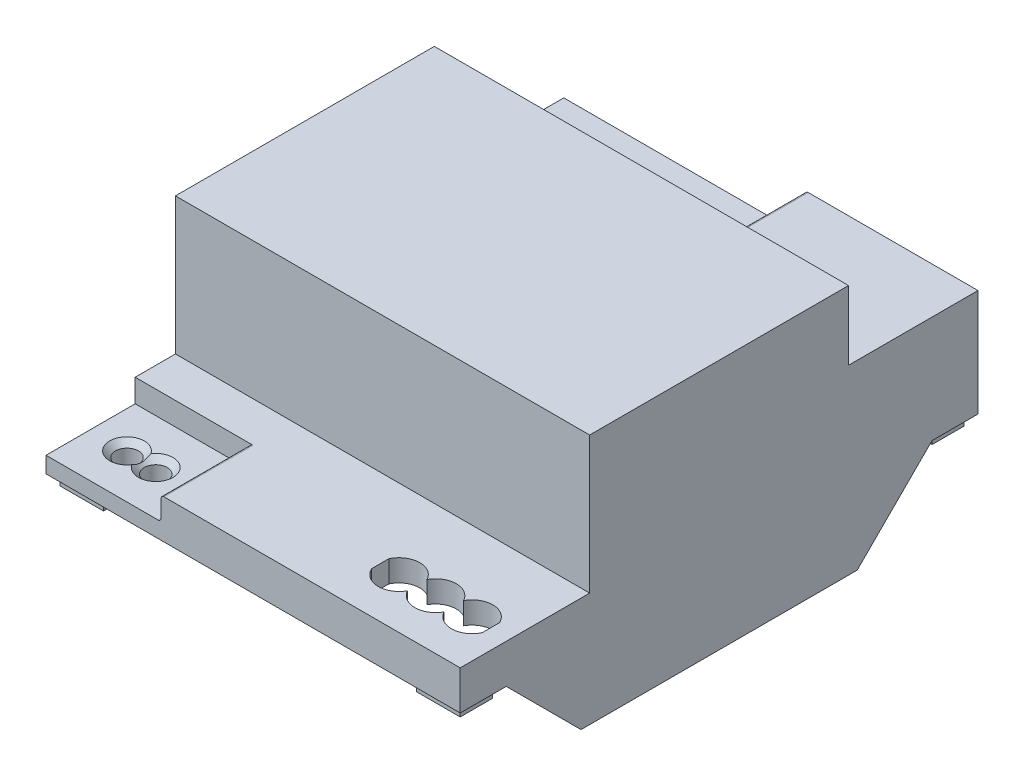
from build123d import *

# Parameters (mm, degrees)
SKETCH_1_W            = 72
SKETCH_1_H            = 90
EXTRUDE_1_DEPTH       = 43.6
CUT_EXTRUDE_1_DEPTH   = 72
SKETCH_3_W            = 22.5
SKETCH_3_H            = 23.8
CUT_EXTRUDE_2_DEPTH   = 72
CUT_EXTRUDE_4_DEPTH   = 16
SKETCH_6_W            = 68
SKETCH_6_H            = 41
CUT_EXTRUDE_5_DEPTH   = 42
EXTRUDE_2_DEPTH       = 1.8
MIRROR_5_COPY_1_DEPTH = 1.8
CUT_EXTRUDE_6_DEPTH   = 3.8
SKETCH_10_W           = 20
SKETCH_10_H           = 22.5
EXTRUDE_3_DEPTH       = 4
SKETCH_9_W            = 15.5
SKETCH_9_H            = 4
CUT_EXTRUDE_7_DEPTH   = 20
SKETCH_11_R           = 2
CUT_EXTRUDE_8_DEPTH   = 4
CHAMFER_1_SIZE        = 1
SKETCH_13_W           = 20
SKETCH_13_H           = 7
CUT_EXTRUDE_10_DEPTH  = 1.6
SKETCH_15_W           = 48
SKETCH_15_H           = 7
EXTRUDE_4_DEPTH       = 2.4
SKETCH_14_R           = 1.75
CUT_EXTRUDE_11_DEPTH  = 5
SKETCH_16_W           = 68
SKETCH_16_H           = 22.5
CUT_EXTRUDE_12_DEPTH  = 30
SKETCH_19_W           = 16
SKETCH_19_H           = 14
CUT_EXTRUDE_13_DEPTH  = 2
SKETCH_20_R           = 4
SKETCH_20_R_2         = 1.75
SKETCH_20_W           = 6.2
SKETCH_20_H           = 6.2
EXTRUDE_5_DEPTH       = 16.4
SKETCH_21_W           = 2.6
SKETCH_21_H           = 3
CUT_EXTRUDE_14_DEPTH  = 2
SKETCH_22_R           = 1.75
EXTRUDE_6_DEPTH       = 11.4
SKETCH_24_W           = 43
SKETCH_24_H           = 22.5
EXTRUDE_7_DEPTH       = 7.5
CHAMFER_3_SIZE        = 0.5
SKETCH_28_W           = 22.5
SKETCH_28_H           = 12
CUT_EXTRUDE_17_DEPTH  = 72
SKETCH_29_W           = 22.5
SKETCH_29_H           = 7
CUT_EXTRUDE_18_DEPTH  = 42
CUT_EXTRUDE_19_DEPTH  = 4
FILLET_3_R            = 0.2
CHAMFER_4_SIZE        = 0.2
SKETCH_31_W           = 20
SKETCH_31_H           = 0.8
EXTRUDE_8_DEPTH       = 1.8
FILLET_4_R            = 0.5


with BuildPart() as part:
    # 草图1 → 凸台-拉伸1 (new body)
    with BuildSketch(Plane(origin=(0, 0, 0), x_dir=(1, 0, 0), z_dir=(0, 1, 0))):
        Rectangle(SKETCH_1_W, SKETCH_1_H)
    extrude(amount=EXTRUDE_1_DEPTH)

    # 草图2 → 切除-拉伸1 (cut)
    with BuildSketch(Plane(origin=(36, 0, 0), x_dir=(0, 0, -1), z_dir=(1, 0, 0))):
        Polygon((-45, 0), (-45, 13), (-37, 13), (-24, 0), align=None)
    cut_extrude_1 = extrude(amount=-CUT_EXTRUDE_1_DEPTH, mode=Mode.SUBTRACT)

    # 镜向1: 切除-拉伸1 across plane
    add(cut_extrude_1.mirror(Plane(origin=(0, 0, 0), x_dir=(1, 0, 0), z_dir=(0, 0, -1))), mode=Mode.SUBTRACT)

    # 草图3 → 切除-拉伸2 (cut)
    with BuildSketch(Plane(origin=(36, 0, 0), x_dir=(0, 0, -1), z_dir=(1, 0, 0))):
        with Locations((-33.75, 31.7)):
            Rectangle(SKETCH_3_W, SKETCH_3_H)
    extrude(amount=-CUT_EXTRUDE_2_DEPTH, mode=Mode.SUBTRACT)

    # 草图5 → 切除-拉伸4 (cut)
    with BuildSketch(Plane.XZ):
        Polygon((-34, 20.5), (34, 20.5), (34, 37), (34, 43), (-34, 43), (-34, 37), align=None)
    extrude(amount=-CUT_EXTRUDE_4_DEPTH, mode=Mode.SUBTRACT)

    # 草图6 → 切除-拉伸5 (cut)
    with BuildSketch(Plane.XZ):
        Rectangle(SKETCH_6_W, SKETCH_6_H)
    extrude(amount=-CUT_EXTRUDE_5_DEPTH, mode=Mode.SUBTRACT)

    # 草图7 → 凸台-拉伸2 (add)
    with BuildSketch(Plane.XZ.offset(-13)):
        Polygon((-34, 38.2), (-34.8, 38.2), (-34.8, 43.8), (-27.2, 43.8), (-27.2, 43), (-34, 43), align=None)
    extrude_2 = extrude(amount=EXTRUDE_2_DEPTH)

    # 镜向4: 凸台-拉伸2 across plane
    add(extrude_2.mirror(Plane(origin=(0, 0, 0), x_dir=(0, 0, 1), z_dir=(1, 0, 0))))

    # 镜向5: 凸台-拉伸2 across plane
    add(extrude_2.mirror(Plane.XY))

    # 镜向5 copy 1 sketch → 镜向5 copy 1 (add)
    with BuildSketch(Plane(origin=(0, 13, 0), x_dir=(-1, 0, 0), z_dir=(0, -1, 0))):
        Polygon((-34, 38.2), (-34.8, 38.2), (-34.8, 43.8), (-27.2, 43.8), (-27.2, 43), (-34, 43), align=None)
    extrude(amount=MIRROR_5_COPY_1_DEPTH)

    # 草图8 → 切除-拉伸6 (cut)
    with BuildSketch(Plane(origin=(0, 19.8, 0), x_dir=(1, 0, 0), z_dir=(0, 1, 0))):
        with BuildLine():
            Line((32.62, -37.774782593), (32.62, -34.785217407))
            ThreePointArc((32.62, -34.785217407), (29.457738833, -32.681765717), (26.17, -34.583127878))
            ThreePointArc((26.17, -34.583127878), (22.995, -32.68), (19.82, -34.583127878))
            ThreePointArc((19.82, -34.583127878), (16.532261167, -32.681765717), (13.37, -34.785217407))
            Line((13.37, -34.785217407), (13.37, -37.774782593))
            ThreePointArc((13.37, -37.774782593), (16.532261167, -39.878234283), (19.82, -37.976872122))
            ThreePointArc((19.82, -37.976872122), (22.995, -39.88), (26.17, -37.976872122))
            ThreePointArc((26.17, -37.976872122), (29.457738833, -39.878234283), (32.62, -37.774782593))
        make_face()
    extrude(amount=-CUT_EXTRUDE_6_DEPTH, mode=Mode.SUBTRACT)

    # 草图10 → 凸台-拉伸3 (add)
    with BuildSketch(Plane.XZ.offset(-16)):
        with Locations((-24, 31.75)):
            Rectangle(SKETCH_10_W, SKETCH_10_H)
    extrude(amount=EXTRUDE_3_DEPTH)

    # 草图9 → 切除-拉伸7 (cut)
    with BuildSketch(Plane.ZY.offset(36)):
        with Locations((37.25, 17.8)):
            Rectangle(SKETCH_9_W, SKETCH_9_H)
    extrude(amount=-CUT_EXTRUDE_7_DEPTH, mode=Mode.SUBTRACT)

    # 草图11 → 切除-拉伸8 (cut)
    with BuildSketch(Plane(origin=(0, 15.8, 0), x_dir=(1, 0, 0), z_dir=(0, 1, 0))):
        with Locations(Location((-29.622, -37.3, 0), (0, 0, 270))):
            Circle(SKETCH_11_R)
        with Locations(Location((-24.622, -37.3, 0), (0, 0, 270))):
            Circle(SKETCH_11_R)
    extrude(amount=-CUT_EXTRUDE_8_DEPTH, mode=Mode.SUBTRACT)

    # 倒角1
    # the kernel refuses this chamfer: 1 mm, written as the material it takes off along each edge
    with BuildSketch(Plane(origin=(-29.622, 15.8, 37.3), x_dir=(0, 0, 1), z_dir=(-1, 0, 0))) as chamfer_1_piece_1:
        Polygon((2 + CHAMFER_1_SIZE, 0), (2, -CHAMFER_1_SIZE), (2, 0), align=None)
    revolve(axis=Axis((-29.622, 15.8, 37.3), (0, 1, 0)), mode=Mode.SUBTRACT)
    with BuildSketch(Plane(origin=(-24.622, 15.8, 37.3), x_dir=(0, 0, 1), z_dir=(-1, 0, 0))) as chamfer_1_piece_2:
        Polygon((2 + CHAMFER_1_SIZE, 0), (2, -CHAMFER_1_SIZE), (2, 0), align=None)
    revolve(axis=Axis((-24.622, 15.8, 37.3), (0, 1, 0)), mode=Mode.SUBTRACT)

    # 草图13 → 切除-拉伸10 (cut)
    with BuildSketch(Plane.XZ.offset(-12)):
        with Locations((-24, 24)):
            Rectangle(SKETCH_13_W, SKETCH_13_H)
    extrude(amount=-CUT_EXTRUDE_10_DEPTH, mode=Mode.SUBTRACT)

    # 草图15 → 凸台-拉伸4 (add)
    with BuildSketch(Plane.XZ.offset(-16)):
        with Locations((10, 24)):
            Rectangle(SKETCH_15_W, SKETCH_15_H)
    extrude(amount=EXTRUDE_4_DEPTH)

    # 草图14 → 切除-拉伸11 (cut)
    with BuildSketch(Plane.XZ.offset(-13.6)):
        with Locations(Location((-26, 24, 0), (0, 0, 270))):
            Circle(SKETCH_14_R)
        with Locations(Location((-6, 24, 0), (0, 0, 270))):
            Circle(SKETCH_14_R)
    extrude(amount=-CUT_EXTRUDE_11_DEPTH, mode=Mode.SUBTRACT)

    # 草图16 → 切除-拉伸12 (cut)
    with BuildSketch(Plane.XZ):
        with Locations((0, -31.75)):
            Rectangle(SKETCH_16_W, SKETCH_16_H)
    extrude(amount=-CUT_EXTRUDE_12_DEPTH, mode=Mode.SUBTRACT)

    # 草图19 → 切除-拉伸13 (cut)
    with BuildSketch(Plane(origin=(0, 0, -45), x_dir=(-1, 0, 0), z_dir=(0, 0, -1))):
        with Locations((-19, 20.6)):
            Rectangle(SKETCH_19_W, SKETCH_19_H)
    extrude(amount=-CUT_EXTRUDE_13_DEPTH, mode=Mode.SUBTRACT)

    # 草图20 → 凸台-拉伸5 (add)
    # profile 1 of 3: a face of its own
    with BuildSketch(Plane.XZ.offset(-30)):
        with Locations((5, -39.8)):
            Circle(SKETCH_20_R)
        with Locations(Location((5, -39.8, 0), (0, 0, 270))):
            Circle(SKETCH_20_R_2, mode=Mode.SUBTRACT)
    # profile 2 of 3: a face of its own
    with BuildSketch(Plane.XZ.offset(-30)):
        with Locations((-30.9, -39.9)):
            Rectangle(SKETCH_20_W, SKETCH_20_H)
        with Locations(Location((-30.8, -39.8, 0), (0, 0, 270))):
            Circle(SKETCH_20_R_2, mode=Mode.SUBTRACT)
    # profile 3 of 3: a face of its own
    with BuildSketch(Plane.XZ.offset(-30)):
        with Locations((30.9, -39.9)):
            Rectangle(SKETCH_20_W, SKETCH_20_H)
        with Locations(Location((30.8, -39.8, 0), (0, 0, 270))):
            Circle(SKETCH_20_R_2, mode=Mode.SUBTRACT)
    extrude(amount=EXTRUDE_5_DEPTH)

    # 草图21 → 切除-拉伸14 (cut)
    with BuildSketch(Plane(origin=(0, 0, -45), x_dir=(-1, 0, 0), z_dir=(0, 0, -1))):
        with Locations((24.76, 16)):
            Rectangle(SKETCH_21_W, SKETCH_21_H)
        with Locations((20.95, 16)):
            Rectangle(SKETCH_21_W, SKETCH_21_H)
        with Locations((17.14, 16)):
            Rectangle(SKETCH_21_W, SKETCH_21_H)
        with Locations((9.76, 16)):
            Rectangle(SKETCH_21_W, SKETCH_21_H)
        with Locations((5.95, 16)):
            Rectangle(SKETCH_21_W, SKETCH_21_H)
        with Locations((2.14, 16)):
            Rectangle(SKETCH_21_W, SKETCH_21_H)
    extrude(amount=-CUT_EXTRUDE_14_DEPTH, mode=Mode.SUBTRACT)

    # 草图22 → 凸台-拉伸6 (add)
    with BuildSketch(Plane.XZ.offset(-30)):
        with Locations(Location((30.8, -39.8, 0), (0, 0, 270))):
            Circle(SKETCH_22_R)
        with Locations(Location((5, -39.8, 0), (0, 0, 270))):
            Circle(SKETCH_22_R)
        with Locations(Location((-30.8, -39.8, 0), (0, 0, 270))):
            Circle(SKETCH_22_R)
    extrude(amount=EXTRUDE_6_DEPTH)

    # 草图24 → 凸台-拉伸7 (add)
    with BuildSketch(Plane.XZ.offset(-30)):
        with Locations((-12.5, -31.75)):
            Rectangle(SKETCH_24_W, SKETCH_24_H)
    extrude(amount=EXTRUDE_7_DEPTH)

    # 倒角3
    chamfer_3_edges = [part.edges().sort_by_distance(p)[0] for p in [
        (-23.46, 16, -45),
        (-24.76, 14.5, -45),
        (-26.06, 16, -45),
        (-24.76, 17.5, -45),
        (-19.65, 16, -45),
        (-20.95, 14.5, -45),
        (-22.25, 16, -45),
        (-20.95, 17.5, -45),
        (-15.84, 16, -45),
        (-17.14, 14.5, -45),
        (-18.44, 16, -45),
        (-17.14, 17.5, -45),
        (-8.46, 16, -45),
        (-9.76, 14.5, -45),
        (-11.06, 16, -45),
        (-9.76, 17.5, -45),
        (-4.65, 16, -45),
        (-5.95, 14.5, -45),
        (-7.25, 16, -45),
        (-5.95, 17.5, -45),
        (-0.84, 16, -45),
        (-2.14, 14.5, -45),
        (-3.44, 16, -45),
        (-2.14, 17.5, -45),
    ]]
    chamfer(chamfer_3_edges, length=CHAMFER_3_SIZE)

    # 草图28 → 切除-拉伸17 (cut)
    with BuildSketch(Plane(origin=(36, 0, 0), x_dir=(0, 0, -1), z_dir=(1, 0, 0))):
        with Locations((33.75, 37.6)):
            Rectangle(SKETCH_28_W, SKETCH_28_H)
    extrude(amount=-CUT_EXTRUDE_17_DEPTH, mode=Mode.SUBTRACT)

    # 草图29 → 切除-拉伸18 (cut)
    with BuildSketch(Plane.ZY.offset(36)):
        with Locations((-33.75, 28.1)):
            Rectangle(SKETCH_29_W, SKETCH_29_H)
    extrude(amount=-CUT_EXTRUDE_18_DEPTH, mode=Mode.SUBTRACT)

    # 草图30 → 切除-拉伸19 (cut)
    with BuildSketch(Plane(origin=(0, 24.6, 0), x_dir=(1, 0, 0), z_dir=(0, 1, 0))):
        with BuildLine():
            ThreePointArc((-22.905, 39.859077171), (-26.81, 39.25), (-22.905, 38.640922829))
            ThreePointArc((-22.905, 38.640922829), (-21, 37.25), (-19.095, 38.640922829))
            ThreePointArc((-19.095, 38.640922829), (-15.19, 39.25), (-19.095, 39.859077171))
            ThreePointArc((-19.095, 39.859077171), (-21, 41.25), (-22.905, 39.859077171))
        make_face()
        with BuildLine():
            ThreePointArc((-7.905, 39.859077171), (-11.81, 39.25), (-7.905, 38.640922829))
            ThreePointArc((-7.905, 38.640922829), (-6, 37.25), (-4.095, 38.640922829))
            ThreePointArc((-4.095, 38.640922829), (-0.19, 39.25), (-4.095, 39.859077171))
            ThreePointArc((-4.095, 39.859077171), (-6, 41.25), (-7.905, 39.859077171))
        make_face()
    extrude(amount=-CUT_EXTRUDE_19_DEPTH, mode=Mode.SUBTRACT)

    # 圆角3
    fillet_3_edges = [part.edges().sort_by_distance(p)[0] for p in [
        (-22.905, 23.55, -39.859077171),
        (-19.095, 23.55, -39.859077171),
        (-19.095, 23.55, -38.640922829),
        (-22.905, 23.55, -38.640922829),
        (-7.905, 23.55, -39.859077171),
        (-4.095, 23.55, -39.859077171),
        (-4.095, 23.55, -38.640922829),
        (-7.905, 23.55, -38.640922829),
    ]]
    fillet(fillet_3_edges, radius=FILLET_3_R)

    # 倒角4
    chamfer_4_edges = [part.edges().sort_by_distance(p)[0] for p in [
        (-6, 24.6, -37.25),
        (-26.81, 24.6, -39.25),
        (-21, 24.6, -41.25),
        (-15.19, 24.6, -39.25),
        (-21, 24.6, -37.25),
        (-11.81, 24.6, -39.25),
        (-6, 24.6, -41.25),
        (-0.19, 24.6, -39.25),
        (-19.095, 24.6, -40.150443093),
        (-22.905, 24.6, -40.150443093),
        (-22.905, 24.6, -38.349556907),
        (-19.095, 24.6, -38.349556907),
        (-7.905, 24.6, -40.150443093),
        (-4.095, 24.6, -40.150443093),
        (-4.095, 24.6, -38.349556907),
        (-7.905, 24.6, -38.349556907),
    ]]
    chamfer(chamfer_4_edges, length=CHAMFER_4_SIZE)

    # 草图31 → 凸台-拉伸8 (add)
    with BuildSketch(Plane.XZ.offset(-13)):
        with Locations((17.2, -43.4)):
            Rectangle(SKETCH_31_W, SKETCH_31_H)
    extrude(amount=EXTRUDE_8_DEPTH)

    # 圆角4
    fillet_4_edges = [part.edges().sort_by_distance(p)[0] for p in [
        (-16, 15.8, 37.25),
        (-16, 19.8, 37.25),
        (6, 31.6, -33.75),
        (6, 24.6, -33.75),
    ]]
    fillet(fillet_4_edges, radius=FILLET_4_R)


solid = part.part
